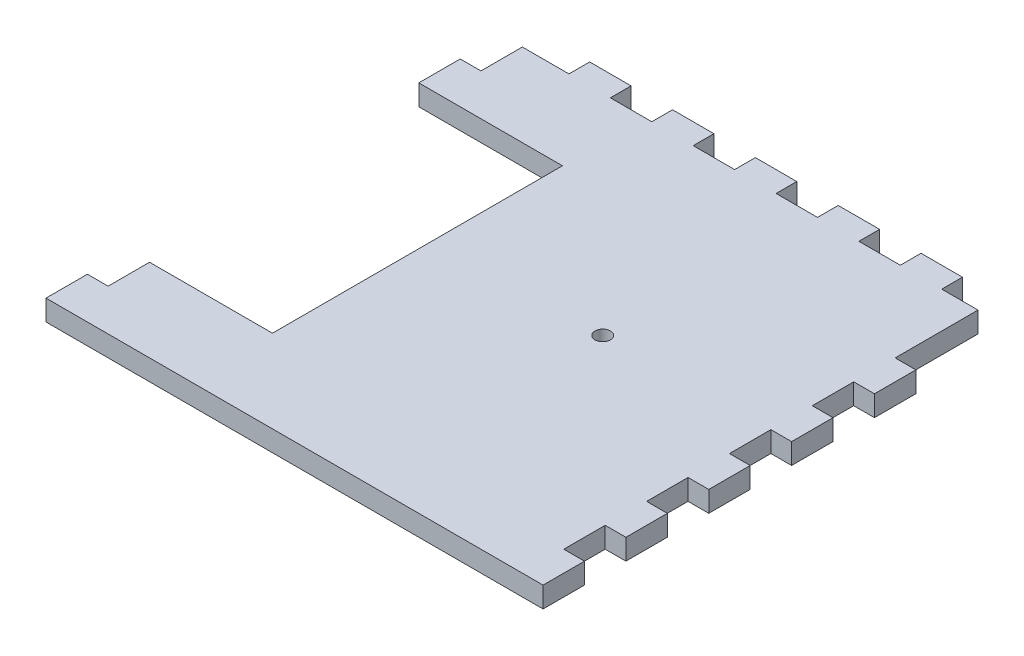
from build123d import *

# Parameters (mm, degrees)
SKETCH1_W               = 279.4
SKETCH1_H               = 279.4
BOSS_EXTRUDE1_DEPTH     = 12.7
SKETCH2_W               = 25.4
SKETCH2_H               = 12.7
BOSS_EXTRUDE2_DEPTH     = 12.7
LPATTERN1_COUNT         = 5
LPATTERN1_PITCH         = 50.8
MIRROR1_COPY_1_SKETCH_W = 25.4
MIRROR1_COPY_1_SKETCH_H = 12.7
MIRROR1_COPY_1_DEPTH    = 12.7
MIRROR1_COPY_2_SKETCH_W = 25.4
MIRROR1_COPY_2_SKETCH_H = 12.7
MIRROR1_COPY_2_DEPTH    = 12.7
MIRROR1_COPY_3_SKETCH_W = 25.4
MIRROR1_COPY_3_SKETCH_H = 12.7
MIRROR1_COPY_3_DEPTH    = 12.7
MIRROR1_COPY_4_SKETCH_W = 25.4
MIRROR1_COPY_4_SKETCH_H = 12.7
MIRROR1_COPY_4_DEPTH    = 12.7
MIRROR1_COPY_5_SKETCH_W = 25.4
MIRROR1_COPY_5_SKETCH_H = 12.7
MIRROR1_COPY_5_DEPTH    = 12.7
SKETCH3_W               = 25.4
SKETCH3_H               = 12.7
BOSS_EXTRUDE3_DEPTH     = 12.7
LPATTERN2_COUNT         = 5
LPATTERN2_PITCH         = 50.8
SKETCH6_R               = 4.7625
CUT_EXTRUDE1_DEPTH      = 216.9
SKETCH8_W               = 88.066093183
SKETCH8_H               = 177.8
CUT_EXTRUDE3_DEPTH      = 216.9
SKETCH9_W               = 25.4
SKETCH9_H               = 12.7
BOSS_EXTRUDE4_DEPTH     = 12.7


with BuildPart() as part:
    # Sketch1 → Boss-Extrude1 (new body)
    with BuildSketch(Plane(origin=(0, 0, 0), x_dir=(1, 0, 0), z_dir=(0, 1, 0))):
        Rectangle(SKETCH1_W, SKETCH1_H)
    extrude(amount=BOSS_EXTRUDE1_DEPTH)

    # Sketch2 → Boss-Extrude2 (add)
    with BuildSketch(Plane(origin=(139.7, 0, 0), x_dir=(0, 0, -1), z_dir=(1, 0, 0))):
        with Locations((-127, 6.35)):
            Rectangle(SKETCH2_W, SKETCH2_H)
    boss_extrude2 = extrude(amount=BOSS_EXTRUDE2_DEPTH)

    # LPattern1: Boss-Extrude2 ×5
    with Locations(*[(0, 0, -i * LPATTERN1_PITCH) for i in range(1, LPATTERN1_COUNT)]):
        add(boss_extrude2)

    # Mirror1 copy 1 sketch → Mirror1 copy 1 (add)
    with BuildSketch(Plane(origin=(-139.7, 0, -50.8), x_dir=(0, 0, -1), z_dir=(-1, 0, 0))):
        with Locations((-127, -6.35)):
            Rectangle(MIRROR1_COPY_1_SKETCH_W, MIRROR1_COPY_1_SKETCH_H)
    extrude(amount=MIRROR1_COPY_1_DEPTH)

    # Mirror1 copy 2 sketch → Mirror1 copy 2 (add)
    with BuildSketch(Plane(origin=(-139.7, 0, -101.6), x_dir=(0, 0, -1), z_dir=(-1, 0, 0))):
        with Locations((-127, -6.35)):
            Rectangle(MIRROR1_COPY_2_SKETCH_W, MIRROR1_COPY_2_SKETCH_H)
    extrude(amount=MIRROR1_COPY_2_DEPTH)

    # Mirror1 copy 3 sketch → Mirror1 copy 3 (add)
    with BuildSketch(Plane(origin=(-139.7, 0, -152.4), x_dir=(0, 0, -1), z_dir=(-1, 0, 0))):
        with Locations((-127, -6.35)):
            Rectangle(MIRROR1_COPY_3_SKETCH_W, MIRROR1_COPY_3_SKETCH_H)
    extrude(amount=MIRROR1_COPY_3_DEPTH)

    # Mirror1 copy 4 sketch → Mirror1 copy 4 (add)
    with BuildSketch(Plane(origin=(-139.7, 0, -203.2), x_dir=(0, 0, -1), z_dir=(-1, 0, 0))):
        with Locations((-127, -6.35)):
            Rectangle(MIRROR1_COPY_4_SKETCH_W, MIRROR1_COPY_4_SKETCH_H)
    extrude(amount=MIRROR1_COPY_4_DEPTH)

    # Mirror1 copy 5 sketch → Mirror1 copy 5 (add)
    with BuildSketch(Plane(origin=(-139.7, 0, 0), x_dir=(0, 0, -1), z_dir=(-1, 0, 0))):
        with Locations((-127, -6.35)):
            Rectangle(MIRROR1_COPY_5_SKETCH_W, MIRROR1_COPY_5_SKETCH_H)
    extrude(amount=MIRROR1_COPY_5_DEPTH)

    # Sketch3 → Boss-Extrude3 (add)
    with BuildSketch(Plane(origin=(0, 0, -139.7), x_dir=(-1, 0, 0), z_dir=(0, 0, -1))):
        with Locations((-104.775, 6.35)):
            Rectangle(SKETCH3_W, SKETCH3_H)
    boss_extrude3 = extrude(amount=BOSS_EXTRUDE3_DEPTH)

    # LPattern2: Boss-Extrude3 ×5
    with Locations(*[(-i * LPATTERN2_PITCH, 0, 0) for i in range(1, LPATTERN2_COUNT)]):
        add(boss_extrude3)

    # Sketch6 → Cut-Extrude1 (cut, through all)
    with BuildSketch(Plane(origin=(0, 12.7, 0), x_dir=(1, 0, 0), z_dir=(0, 1, 0))):
        with Locations((38.1, 11.176)):
            Circle(SKETCH6_R)
    extrude(amount=-CUT_EXTRUDE1_DEPTH, mode=Mode.SUBTRACT)

    # Sketch8 → Cut-Extrude3 (cut, through all)
    with BuildSketch(Plane(origin=(0, 12.7, 0), x_dir=(1, 0, 0), z_dir=(0, 1, 0))):
        with Locations((-108.366953408, 0)):
            Rectangle(SKETCH8_W, SKETCH8_H)
    extrude(amount=-CUT_EXTRUDE3_DEPTH, mode=Mode.SUBTRACT)

    # Sketch9 → Boss-Extrude4 (add)
    with BuildSketch(Plane.ZY.offset(139.7)):
        with Locations((-101.6, 6.35)):
            Rectangle(SKETCH9_W, SKETCH9_H)
    extrude(amount=BOSS_EXTRUDE4_DEPTH)


solid = part.part
